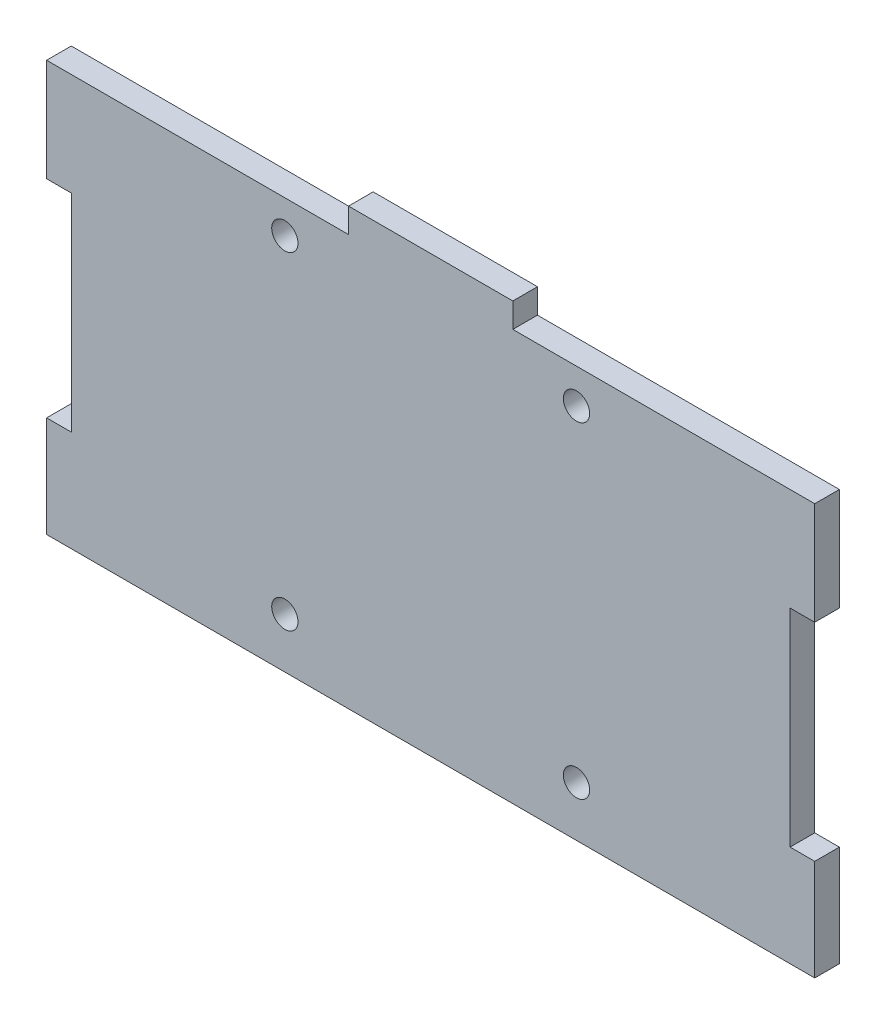
from build123d import *

# Parameters (mm, degrees)
BOSS_EXTRU_1_DEPTH = 3
ESQUISSE2_W        = 20
ESQUISSE2_H        = 3
BOSS_EXTRU_2_DEPTH = 3
SKETCH1_R          = 1.6
CUT_EXTRUDE1_DEPTH = 55.576208186
SKETCH2_R          = 1.6
CUT_EXTRUDE2_DEPTH = 55.576208186
SKETCH3_R          = 1.6
CUT_EXTRUDE3_DEPTH = 55.576208186


with BuildPart() as part:
    # Esquisse1 → Boss.-Extru.1 (new body)
    with BuildSketch(Plane.XY):
        Polygon((46.75, -25), (-46.75, -25), (-46.75, -12.7), (-43.75, -12.7), (-43.75, 12.5), (-46.75, 12.5), (-46.75, 25), (-26.2, 25), (-23, 25), (23, 25), (26.2, 25), (46.75, 25), (46.75, 12.5), (43.75, 12.5), (43.75, -12.7), (46.75, -12.7), align=None)
    extrude(amount=BOSS_EXTRU_1_DEPTH)

    # Esquisse2 → Boss.-Extru.2 (add)
    with BuildSketch(Plane.XY.offset(3)):
        with Locations((0, 26.5)):
            Rectangle(ESQUISSE2_W, ESQUISSE2_H)
    extrude(amount=-BOSS_EXTRU_2_DEPTH)

    # Sketch1 → Cut-Extrude1 (cut, through all)
    with BuildSketch(Plane.XY.offset(3)):
        with Locations((-17.75, 21)):
            Circle(SKETCH1_R)
    extrude(amount=-CUT_EXTRUDE1_DEPTH, mode=Mode.SUBTRACT)

    # Sketch2 → Cut-Extrude2 (cut, through all)
    with BuildSketch(Plane(origin=(0, 0, 0), x_dir=(-1, 0, 0), z_dir=(0, 0, -1))):
        with Locations((-17.75, 20.8)):
            Circle(SKETCH2_R)
    extrude(amount=-CUT_EXTRUDE2_DEPTH, mode=Mode.SUBTRACT)

    # Sketch3 → Cut-Extrude3 (cut, through all)
    with BuildSketch(Plane.XY.offset(3)):
        with Locations((17.75, -18.9)):
            Circle(SKETCH3_R)
        with Locations((-17.75, -18.9)):
            Circle(SKETCH3_R)
    extrude(amount=-CUT_EXTRUDE3_DEPTH, mode=Mode.SUBTRACT)


solid = part.part
